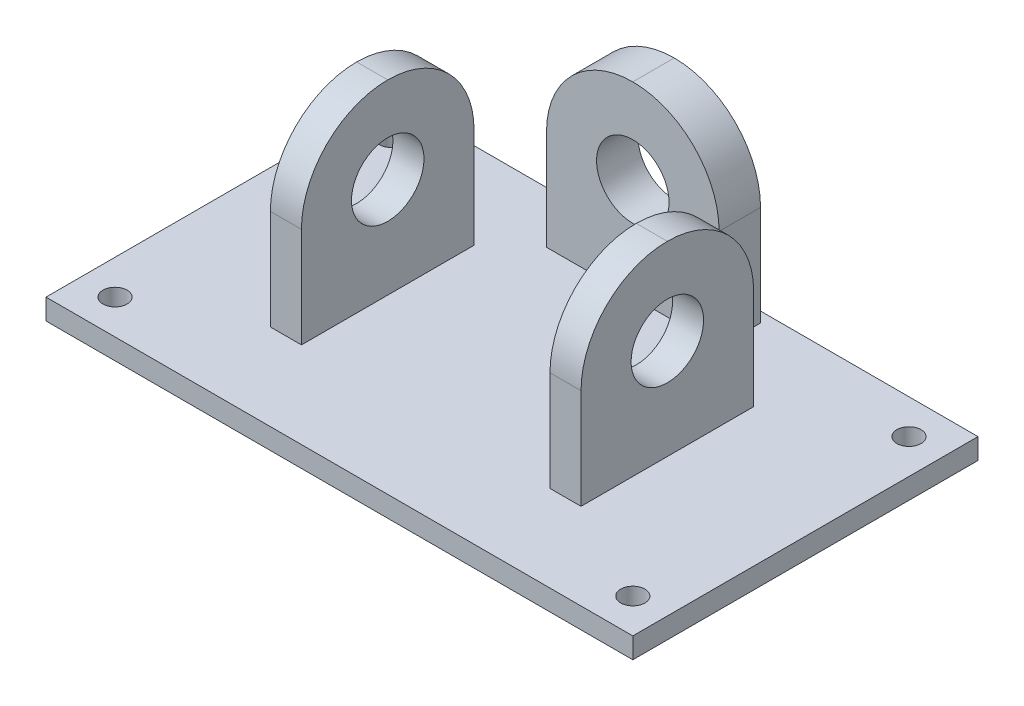
from build123d import *

# Parameters (mm, degrees)
SKICA1_W                          = 85
SKICA1_H                          = 50
P_IDAT_VYSUNUT_M1_DEPTH           = 3
SKICA2_W                          = 4.5
SKICA2_H                          = 25
SKICA2_W_2                        = 25
SKICA2_H_2                        = 6
P_IDAT_VYSUNUT_M2_DEPTH           = 27
ZAOBLIT1_R                        = 12.5
SKICA3_R                          = 5.25
ODEBRAT_VYSUNUT_M1_DEPTH          = 76.828754441
SKICA4_R                          = 5.25
ODEBRAT_VYSUNUT_M2_DEPTH          = 68.175144213
D_RY_PRO_KOL_K_VELIKOST_MM1_D     = 3.5
D_RY_PRO_KOL_K_VELIKOST_MM1_DEPTH = 10
D_RY_PRO_KOL_K_VELIKOST_MM1_TIP   = 1.051506083


with BuildPart() as part:
    # Skica1 → Přidat vysunutím1 (new body)
    with BuildSketch(Plane(origin=(0, 0, 0), x_dir=(1, 0, 0), z_dir=(0, 1, 0))):
        Rectangle(SKICA1_W, SKICA1_H)
    extrude(amount=P_IDAT_VYSUNUT_M1_DEPTH)

    # Skica2 → Přidat vysunutím2 (add)
    with BuildSketch(Plane(origin=(0, 3, 0), x_dir=(1, 0, 0), z_dir=(0, 1, 0))):
        with Locations((-20.25, 0)):
            Rectangle(SKICA2_W, SKICA2_H)
        with Locations((0, 20.5)):
            Rectangle(SKICA2_W_2, SKICA2_H_2)
        with Locations((20.25, 0)):
            Rectangle(SKICA2_W, SKICA2_H)
    extrude(amount=P_IDAT_VYSUNUT_M2_DEPTH)

    # Zaoblit1
    zaoblit1_edges = [part.edges().sort_by_distance(p)[0] for p in [
        (-20.25, 30, -12.5),
        (-20.25, 30, 12.5),
        (-12.5, 30, -20.5),
        (12.5, 30, -20.5),
        (20.25, 30, -12.5),
        (20.25, 30, 12.5),
    ]]
    fillet(zaoblit1_edges, radius=ZAOBLIT1_R - 0.0001)  # a hair under: the kernel refuses the full size

    # Skica3 → Odebrat vysunutím1 (cut, through all)
    with BuildSketch(Plane.ZY.offset(22.5)):
        with Locations((0, 17.5)):
            Circle(SKICA3_R)
    extrude(amount=-ODEBRAT_VYSUNUT_M1_DEPTH, mode=Mode.SUBTRACT)

    # Skica4 → Odebrat vysunutím2 (cut, through all)
    with BuildSketch(Plane.XY.offset(-17.5)):
        with Locations((0, 17.5)):
            Circle(SKICA4_R)
    extrude(amount=-ODEBRAT_VYSUNUT_M2_DEPTH, mode=Mode.SUBTRACT)

    # Díry pro kolík, velikost mm1
    with Locations(Plane(origin=(0, 3, 0), x_dir=(1, 0, 0), z_dir=(0, 1, 0))):
        with Locations((-37.5, 20), (37.5, 20), (37.5, -20), (-37.5, -20)):
            Hole(D_RY_PRO_KOL_K_VELIKOST_MM1_D / 2, depth=D_RY_PRO_KOL_K_VELIKOST_MM1_DEPTH)
            with Locations((0, 0, -(D_RY_PRO_KOL_K_VELIKOST_MM1_DEPTH + D_RY_PRO_KOL_K_VELIKOST_MM1_TIP / 2))):  # 118° drill point
                Cone(0, D_RY_PRO_KOL_K_VELIKOST_MM1_D / 2, D_RY_PRO_KOL_K_VELIKOST_MM1_TIP, mode=Mode.SUBTRACT)


solid = part.part
